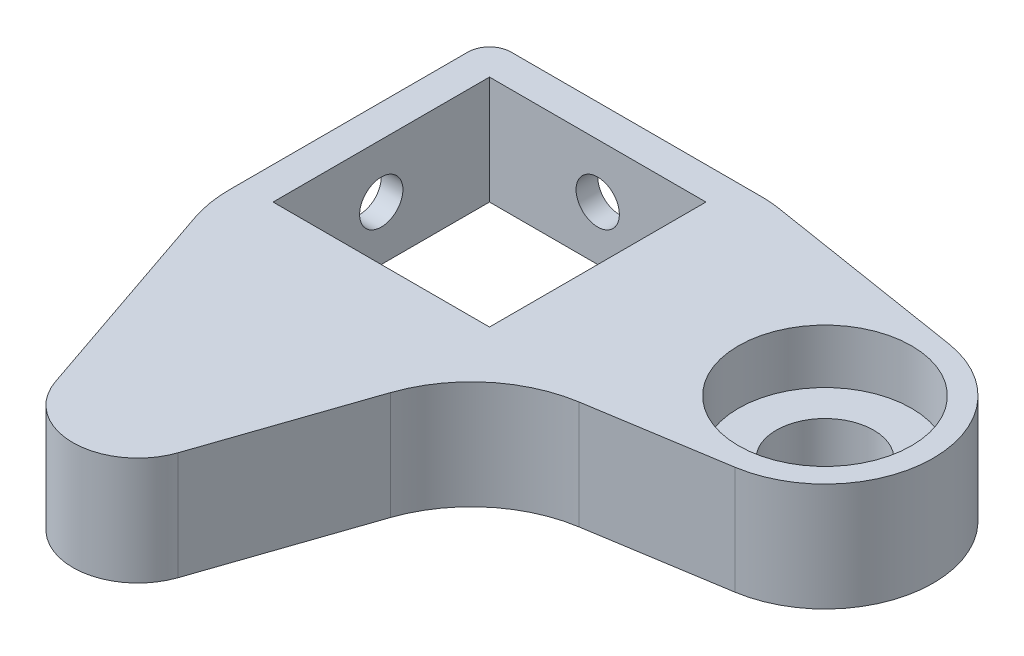
from build123d import *

# Parameters (mm, degrees)
SKETCH1_W                               = 20
SKETCH1_H                               = 20
BOSS_EXTRUDE1_DEPTH                     = 10
SKETCH2_R                               = 8
CUT_EXTRUDE2_DEPTH                      = 46
SKETCH3_R                               = 4
SKETCH3_R_2                             = 4.5
CUT_EXTRUDE3_DEPTH                      = 10
CBORE_FOR_M5_HEX_HEAD_BOLT1_D           = 4
CBORE_FOR_M5_HEX_HEAD_BOLT1_DEPTH       = 10
CBORE_FOR_M5_HEX_HEAD_BOLT1_CBORE_D     = 7
CBORE_FOR_M5_HEX_HEAD_BOLT1_CBORE_DEPTH = 1
CBORE_FOR_M5_HEX_HEAD_BOLT2_D           = 4
CBORE_FOR_M5_HEX_HEAD_BOLT2_DEPTH       = 10
CBORE_FOR_M5_HEX_HEAD_BOLT2_CBORE_D     = 7
CBORE_FOR_M5_HEX_HEAD_BOLT2_CBORE_DEPTH = 1


with BuildPart() as part:
    # Sketch1 → Boss-Extrude1 (new body)
    with BuildSketch(Plane(origin=(0, 0, 0), x_dir=(1, 0, 0), z_dir=(0, 1, 0))):
        with BuildLine():
            Line((23.939871077, 2.849965846), (42.576368333, -0.125028462))
            ThreePointArc((42.576368333, -0.125028462), (51, -10), (42.576368333, -19.874971538))
            Line((42.576368333, -19.874971538), (30.130588759, -21.86172489))
            ThreePointArc((30.130588759, -21.86172489), (24.291669579, -24.533541475), (20.666245259, -29.833341429))
            Line((20.666245259, -29.833341429), (15.677992749, -44.439174654))
            ThreePointArc((15.677992749, -44.439174654), (10, -48.5), (4.322007251, -44.439174654))
            Line((4.322007251, -44.439174654), (-2.355985499, -24.885704137))
            ThreePointArc((-2.355985499, -24.885704137), (-2.837901545, -22.973082941), (-3, -21.00735483))
            Line((-3, -21.00735483), (-3, 1))
            ThreePointArc((-3, 1), (-2.414213562, 2.414213562), (-1, 3))
            Line((-1, 3), (22.048229077, 3))
            ThreePointArc((22.048229077, 3), (22.997020375, 2.962432657), (23.939871077, 2.849965846))
        make_face()
        with Locations((10, -10)):
            Rectangle(SKETCH1_W, SKETCH1_H, mode=Mode.SUBTRACT)
    extrude(amount=BOSS_EXTRUDE1_DEPTH)

    # Sketch2 → Cut-Extrude2 (cut)
    with BuildSketch(Plane(origin=(0, 5, 0), x_dir=(1, 0, 0), z_dir=(0, 1, 0))):
        with Locations((41, -10)):
            Circle(SKETCH2_R)
    extrude(amount=CUT_EXTRUDE2_DEPTH, mode=Mode.SUBTRACT)

    # Sketch3 → Cut-Extrude3 (cut)
    with BuildSketch(Plane(origin=(0, 5, 0), x_dir=(1, 0, 0), z_dir=(0, 1, 0))):
        with Locations((10, -42.5)):
            Circle(SKETCH3_R)
        with Locations((41, -10)):
            Circle(SKETCH3_R_2)
    extrude(amount=-CUT_EXTRUDE3_DEPTH, mode=Mode.SUBTRACT)

    # CBORE for M5 Hex Head Bolt1
    with Locations(Plane.ZY.offset(3)):
        with Locations((10, 5)):
            CounterBoreHole(CBORE_FOR_M5_HEX_HEAD_BOLT1_D / 2, CBORE_FOR_M5_HEX_HEAD_BOLT1_CBORE_D / 2, CBORE_FOR_M5_HEX_HEAD_BOLT1_CBORE_DEPTH, depth=CBORE_FOR_M5_HEX_HEAD_BOLT1_DEPTH)

    # CBORE for M5 Hex Head Bolt2
    with Locations(Plane(origin=(0, 0, -3), x_dir=(-1, 0, 0), z_dir=(0, 0, -1))):
        with Locations((-10, 5)):
            CounterBoreHole(CBORE_FOR_M5_HEX_HEAD_BOLT2_D / 2, CBORE_FOR_M5_HEX_HEAD_BOLT2_CBORE_D / 2, CBORE_FOR_M5_HEX_HEAD_BOLT2_CBORE_DEPTH, depth=CBORE_FOR_M5_HEX_HEAD_BOLT2_DEPTH)


solid = part.part
